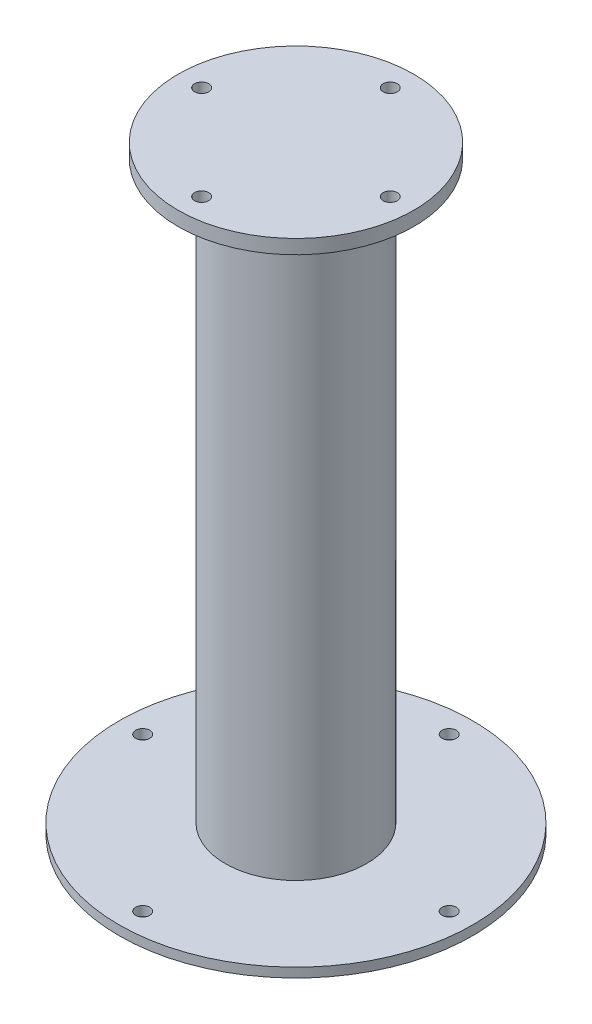
from build123d import *

# Parameters (mm, degrees)
SKETCH2_R           = 37.5
BOSS_EXTRUDE1_DEPTH = 2
SKETCH4_R           = 15
BOSS_EXTRUDE2_DEPTH = 61
SKETCH5_R           = 25
BOSS_EXTRUDE3_DEPTH = 3
CUT_EXTRUDE1_REACH  = 139.628
SKETCH6_R           = 1.5
CUT_EXTRUDE2_REACH  = 139.628
SKETCH7_R           = 1.5
SHELL1_OUTLINE_R    = 13
SHELL1_DEPTH        = 125


# Read off the part's stored shape, not the designer's step: Shell1
with BuildPart() as part:
    # Sketch2 → Boss-Extrude1 (new body)
    with BuildSketch(Plane(origin=(0, 0, 0), x_dir=(1, 0, 0), z_dir=(0, 1, 0))):
        with Locations(Location((0, 0, 0), (0, 0, 270))):
            Circle(SKETCH2_R)
    extrude(amount=BOSS_EXTRUDE1_DEPTH)

    # Sketch4 → Boss-Extrude2 (add)
    with BuildSketch(Plane(origin=(0, 2, 0), x_dir=(1, 0, 0), z_dir=(0, 1, 0))):
        with Locations(Location((0, 0, 0), (0, 0, 90))):
            Circle(SKETCH4_R)
    boss_extrude2 = extrude(amount=BOSS_EXTRUDE2_DEPTH)

    # Mirror1: Boss-Extrude2 across plane
    add(boss_extrude2.mirror(Plane.ZX.offset(63)))

    # Sketch5 → Boss-Extrude3 (add)
    with BuildSketch(Plane(origin=(0, 124, 0), x_dir=(1, 0, 0), z_dir=(0, 1, 0))):
        with Locations(Location((0, 0, 0), (0, 0, 270))):
            Circle(SKETCH5_R)
    extrude(amount=BOSS_EXTRUDE3_DEPTH)

    # Sketch6 → Cut-Extrude1 (cut, up to next)
    with BuildSketch(Plane(origin=(0, 127, 0), x_dir=(1, 0, 0), z_dir=(0, 1, 0)), mode=Mode.PRIVATE) as cut_extrude1_sk1:
        with Locations(Location((0, 20, 0), (0, 0, 270))):
            Circle(SKETCH6_R)
    cut_extrude1_tool1 = extrude(cut_extrude1_sk1.sketch, amount=-CUT_EXTRUDE1_REACH, mode=Mode.PRIVATE) & part.part
    # Sketch6 → Cut-Extrude1 (cut, up to next)
    with BuildSketch(Plane(origin=(0, 127, 0), x_dir=(1, 0, 0), z_dir=(0, 1, 0)), mode=Mode.PRIVATE) as cut_extrude1_sk2:
        with Locations(Location((20, 0, 0), (0, 0, 270))):
            Circle(SKETCH6_R)
    cut_extrude1_tool2 = extrude(cut_extrude1_sk2.sketch, amount=-CUT_EXTRUDE1_REACH, mode=Mode.PRIVATE) & part.part
    # Sketch6 → Cut-Extrude1 (cut, up to next)
    with BuildSketch(Plane(origin=(0, 127, 0), x_dir=(1, 0, 0), z_dir=(0, 1, 0)), mode=Mode.PRIVATE) as cut_extrude1_sk3:
        with Locations(Location((0, -20, 0), (0, 0, 270))):
            Circle(SKETCH6_R)
    cut_extrude1_tool3 = extrude(cut_extrude1_sk3.sketch, amount=-CUT_EXTRUDE1_REACH, mode=Mode.PRIVATE) & part.part
    # Sketch6 → Cut-Extrude1 (cut, up to next)
    with BuildSketch(Plane(origin=(0, 127, 0), x_dir=(1, 0, 0), z_dir=(0, 1, 0)), mode=Mode.PRIVATE) as cut_extrude1_sk4:
        with Locations(Location((-20, 0, 0), (0, 0, 270))):
            Circle(SKETCH6_R)
    cut_extrude1_tool4 = extrude(cut_extrude1_sk4.sketch, amount=-CUT_EXTRUDE1_REACH, mode=Mode.PRIVATE) & part.part
    add(cut_extrude1_tool1.solids().sort_by_distance((0, 127, -20))[0], mode=Mode.SUBTRACT)
    add(cut_extrude1_tool2.solids().sort_by_distance((20, 127, 0))[0], mode=Mode.SUBTRACT)
    add(cut_extrude1_tool3.solids().sort_by_distance((0, 127, 20))[0], mode=Mode.SUBTRACT)
    add(cut_extrude1_tool4.solids().sort_by_distance((-20, 127, 0))[0], mode=Mode.SUBTRACT)

    # Sketch7 → Cut-Extrude2 (cut, up to next)
    with BuildSketch(Plane.XZ, mode=Mode.PRIVATE) as cut_extrude2_sk1:
        with Locations(Location((0, 32.5, 0), (0, 0, 270))):
            Circle(SKETCH7_R)
    cut_extrude2_tool1 = extrude(cut_extrude2_sk1.sketch, amount=-CUT_EXTRUDE2_REACH, mode=Mode.PRIVATE) & part.part
    # Sketch7 → Cut-Extrude2 (cut, up to next)
    with BuildSketch(Plane.XZ, mode=Mode.PRIVATE) as cut_extrude2_sk2:
        with Locations(Location((32.5, 0, 0), (0, 0, 270))):
            Circle(SKETCH7_R)
    cut_extrude2_tool2 = extrude(cut_extrude2_sk2.sketch, amount=-CUT_EXTRUDE2_REACH, mode=Mode.PRIVATE) & part.part
    # Sketch7 → Cut-Extrude2 (cut, up to next)
    with BuildSketch(Plane.XZ, mode=Mode.PRIVATE) as cut_extrude2_sk3:
        with Locations(Location((0, -32.5, 0), (0, 0, 270))):
            Circle(SKETCH7_R)
    cut_extrude2_tool3 = extrude(cut_extrude2_sk3.sketch, amount=-CUT_EXTRUDE2_REACH, mode=Mode.PRIVATE) & part.part
    # Sketch7 → Cut-Extrude2 (cut, up to next)
    with BuildSketch(Plane.XZ, mode=Mode.PRIVATE) as cut_extrude2_sk4:
        with Locations(Location((-32.5, 0, 0), (0, 0, 270))):
            Circle(SKETCH7_R)
    cut_extrude2_tool4 = extrude(cut_extrude2_sk4.sketch, amount=-CUT_EXTRUDE2_REACH, mode=Mode.PRIVATE) & part.part
    add(cut_extrude2_tool1.solids().sort_by_distance((0, 0, 32.5))[0], mode=Mode.SUBTRACT)
    add(cut_extrude2_tool2.solids().sort_by_distance((32.5, 0, 0))[0], mode=Mode.SUBTRACT)
    add(cut_extrude2_tool3.solids().sort_by_distance((0, 0, -32.5))[0], mode=Mode.SUBTRACT)
    add(cut_extrude2_tool4.solids().sort_by_distance((-32.5, 0, 0))[0], mode=Mode.SUBTRACT)

    # Shell1 outline → Shell1 (cut)
    with BuildSketch(Plane(origin=(0, 0, 0), x_dir=(1, 0, 0), z_dir=(0, 1, 0))):
        Circle(SHELL1_OUTLINE_R)
    extrude(amount=SHELL1_DEPTH, mode=Mode.SUBTRACT)


solid = part.part
